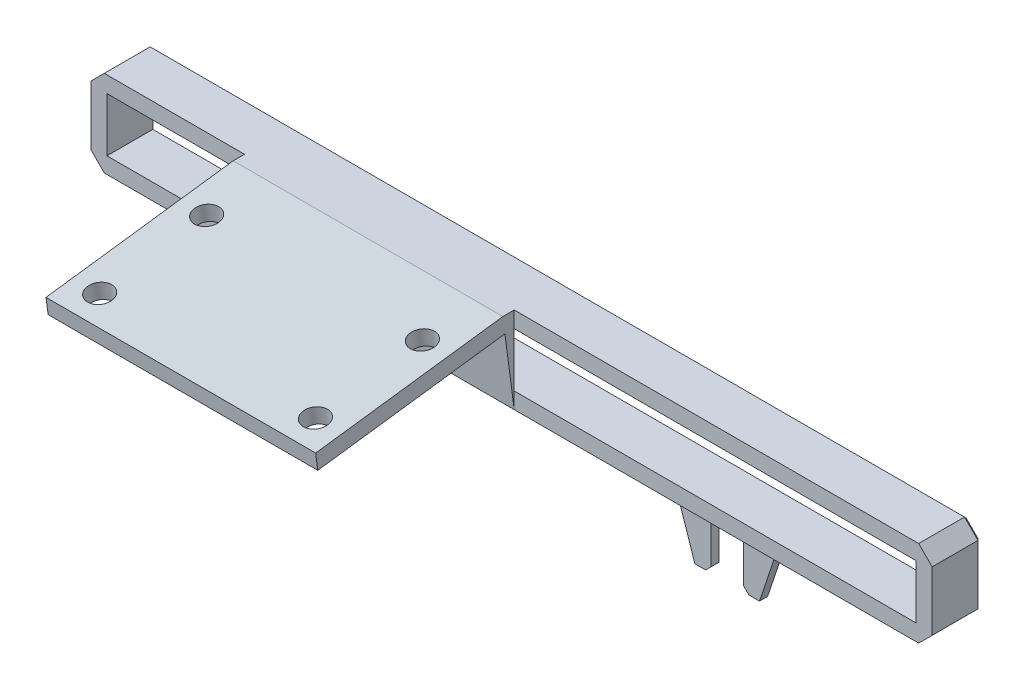
from build123d import *
from OCP.BRepFilletAPI import BRepFilletAPI_MakeChamfer

# Parameters (mm, degrees)
SKETCH1_W            = 156
SKETCH1_H            = 16
BOSS_EXTRUDE1_DEPTH  = 9
SKETCH2_W            = 150
SKETCH2_H            = 10
CUT_EXTRUDE1_DEPTH   = 9
BOSS_EXTRUDE2_START  = -127.5
BOSS_EXTRUDE2_DEPTH  = 50
SKETCH5_W            = 50
SKETCH5_H            = 3
BOSS_EXTRUDE3_DEPTH  = 35
M4_CLEARANCE_HOLE1_D = 4.5
SKETCH10_W           = 12
SKETCH10_H           = 2
BOSS_EXTRUDE4_DEPTH  = 15
SKETCH11_W           = 6
SKETCH11_H           = 11
CUT_EXTRUDE2_DEPTH   = 15
CHAMFER1_SIZE        = 5
CHAMFER1_SIZE_2      = 15
CHAMFER2_SIZE        = 1
CHAMFER3_SIZE        = 2.5
CHAMFER4_SIZE        = 2
CHAMFER5_SIZE        = 0.5


# Some blends are built 0.0001 mm under size
with BuildPart() as part:
    # Sketch1 → Boss-Extrude1 (new body)
    with BuildSketch(Plane.XY):
        with Locations((78, 8)):
            Rectangle(SKETCH1_W, SKETCH1_H)
    extrude(amount=BOSS_EXTRUDE1_DEPTH)

    # Sketch2 → Cut-Extrude1 (cut)
    with BuildSketch(Plane.XY.offset(9)):
        with Locations((78, 8)):
            Rectangle(SKETCH2_W, SKETCH2_H)
    extrude(amount=-CUT_EXTRUDE1_DEPTH, mode=Mode.SUBTRACT)

    # Sketch4 → Boss-Extrude2 (add)
    with BuildSketch(Plane(origin=(156, 0, 0), x_dir=(0, 0, -1), z_dir=(1, 0, 0)).offset(BOSS_EXTRUDE2_START)):
        Polygon((-9, 16), (-11.106439961, 16), (-9, 0), align=None)
    extrude(amount=BOSS_EXTRUDE2_DEPTH)

    # Sketch5 → Boss-Extrude3 (add)
    with BuildSketch(Plane(origin=(0, -1.164685703, 8.846666218), x_dir=(1, 0, 0), z_dir=(0, -0.13052619222004497, 0.9914448613738114))):
        with Locations((53.5, 15.812799099)):
            Rectangle(SKETCH5_W, SKETCH5_H)
    extrude(amount=BOSS_EXTRUDE3_DEPTH)

    # M4 Clearance Hole1 (through all)
    with Locations(Plane(origin=(0, 17.164685703, 2.259773743), x_dir=(1, 0, 0), z_dir=(0, 0.9914448613738114, 0.130526192220045))):
        with Locations((33.5, -18.923003752), (73.5, -18.923003752), (73.5, -38.923003752), (33.5, -38.923003752)):
            Hole(M4_CLEARANCE_HOLE1_D / 2)

    # Sketch10 → Boss-Extrude4 (add)
    with BuildSketch(Plane.XZ):
        with Locations((111, 1)):
            Rectangle(SKETCH10_W, SKETCH10_H)
    extrude(amount=BOSS_EXTRUDE4_DEPTH)

    # Sketch11 → Cut-Extrude2 (cut)
    with BuildSketch(Plane(origin=(0, 0, 0), x_dir=(-1, 0, 0), z_dir=(0, 0, -1))):
        with Locations((-111, -9.5)):
            Rectangle(SKETCH11_W, SKETCH11_H)
    extrude(amount=-CUT_EXTRUDE2_DEPTH, mode=Mode.SUBTRACT)

    # Chamfer1
    chamfer1_edges_1 = [part.edges().sort_by_distance(p)[0] for p in [
        (117, 0, 1),
    ]]
    chamfer1_side_1 = [part.faces().sort_by_distance(p)[0] for p in [
        (117.1, 0, 1),
    ]]
    chamfer1_edges_2 = [part.edges().sort_by_distance(p)[0] for p in [
        (105, 0, 1),
    ]]
    chamfer1_side_2 = [part.faces().sort_by_distance(p)[0] for p in [
        (104.9, 0, 1),
    ]]
    chamfer1 = BRepFilletAPI_MakeChamfer(part.part.solid().wrapped)
    for e in chamfer1_edges_1:
        chamfer1.Add(CHAMFER1_SIZE - 0.0001, CHAMFER1_SIZE_2 - 0.0001, e.wrapped, chamfer1_side_1[0].wrapped)
    for e in chamfer1_edges_2:
        chamfer1.Add(CHAMFER1_SIZE - 0.0001, CHAMFER1_SIZE_2 - 0.0001, e.wrapped, chamfer1_side_2[0].wrapped)
    add(Compound.cast(chamfer1.Shape()), mode=Mode.REPLACE)  # a hair under: the kernel refuses the full size

    # Chamfer2
    chamfer2_edges = [part.edges().sort_by_distance(p)[0] for p in [
        (108, -15, 1),
        (114, -15, 1),
    ]]
    chamfer(chamfer2_edges, length=CHAMFER2_SIZE)

    # Chamfer3
    chamfer3_edges = [part.edges().sort_by_distance(p)[0] for p in [
        (0, 16, 4.5),
        (156, 16, 4.5),
        (156, 0, 4.5),
        (0, 0, 4.5),
    ]]
    chamfer(chamfer3_edges, length=CHAMFER3_SIZE)

    # Chamfer4
    chamfer4_edges = [part.edges().sort_by_distance(p)[0] for p in [
        (111, 0, 2),
    ]]
    chamfer(chamfer4_edges, length=CHAMFER4_SIZE)

    # Chamfer5
    # the kernel refuses this chamfer: 0.5 mm, written as the material it takes off along each edge
    with BuildSketch(Plane(origin=(114, -4, 0), x_dir=(-0.027495876610582174, 0, 0.9996219169112968), z_dir=(0, -1, 0)), Plane(origin=(108, -15.285841494, 0), x_dir=(0.027495876610582174, 0, 0.9996219169112968), z_dir=(0, 1, 0))) as chamfer5_piece_1:
        Polygon((CHAMFER5_SIZE * 0.999621916911, -CHAMFER5_SIZE * 0.0274958766106), (-CHAMFER5_SIZE * 0.0274958766106, -CHAMFER5_SIZE * 0.999621916911), (0, 0), align=None)
    extrude(amount=11.285841494, mode=Mode.SUBTRACT)
    with BuildSketch(Plane(origin=(108, -4, 0), x_dir=(0, -0.02749587661058563, 0.9996219169112968), z_dir=(1, 0, 0))) as chamfer5_piece_2:
        Polygon((CHAMFER5_SIZE * 0.999621916911, -CHAMFER5_SIZE * 0.0274958766106), (-CHAMFER5_SIZE * 0.0274958766106, -CHAMFER5_SIZE * 0.999621916911), (0, 0), align=None)
    extrude(amount=6, mode=Mode.SUBTRACT)
    with BuildSketch(Plane(origin=(120.714058506, 0, 0), x_dir=(0, -0.027495876610586372, 0.9996219169112968), z_dir=(1, 0, 0))) as chamfer5_piece_3_section:
        Polygon((CHAMFER5_SIZE * 0.999621916911, -CHAMFER5_SIZE * 0.0274958766106), (-CHAMFER5_SIZE * 0.0274958766106, -CHAMFER5_SIZE * 0.999621916911), (0, 0), align=None)
    chamfer5_piece_3 = extrude(amount=34.071782988, mode=Mode.PRIVATE)
    chamfer5_piece_3 = split(chamfer5_piece_3, bisect_by=Plane(origin=(123.691323229, 5.074337344, 0.164983246), z_dir=(0.9486845629641077, -0.31622397125075763, 0)), keep=Keep.TOP, mode=Mode.PRIVATE)
    add(chamfer5_piece_3, mode=Mode.SUBTRACT)
    with BuildSketch(Plane(origin=(122.406513904, 1.219857976, 0), x_dir=(0.026084913685623757, -0.008694855294818641, 0.999621916911297), z_dir=(-0.31622397125075763, -0.9486845629641077, 0))) as chamfer5_piece_4_section:
        Polygon((CHAMFER5_SIZE * 0.999621916911, CHAMFER5_SIZE * 0.0274958766106), (-CHAMFER5_SIZE * 0.0274958766106, CHAMFER5_SIZE * 0.999621916911), (0, 0), align=None)
    chamfer5_piece_4 = extrude(amount=18.382944798, mode=Mode.PRIVATE)
    chamfer5_piece_4 = split(chamfer5_piece_4, bisect_by=Plane(origin=(119.414869386, 0, 0.166750545), z_dir=(0, -1, 0)), keep=Keep.TOP, mode=Mode.PRIVATE)
    add(chamfer5_piece_4, mode=Mode.SUBTRACT)
    with BuildSketch(Plane(origin=(99.593486096, 1.219857976, 0), x_dir=(0.948325881374337, 0.31610441231498504, -0.027495876610587087), z_dir=(0.31622397125075763, -0.9486845629641077, 0))) as chamfer5_piece_5_section:
        Polygon((CHAMFER5_SIZE * 0.999621916911, CHAMFER5_SIZE * 0.0274958766106), (-CHAMFER5_SIZE * 0.0274958766106, CHAMFER5_SIZE * 0.999621916911), (0, 0), align=None)
    chamfer5_piece_5 = extrude(amount=18.382944798, mode=Mode.PRIVATE)
    chamfer5_piece_5 = split(chamfer5_piece_5, bisect_by=Plane(origin=(102.585130614, 0, 0.166750545), z_dir=(0, -1, 0)), keep=Keep.TOP, mode=Mode.PRIVATE)
    add(chamfer5_piece_5, mode=Mode.SUBTRACT)
    with BuildSketch(Plane(origin=(118.285841494, -15, 0), x_dir=(0, -0.02749587661058563, 0.9996219169112968), z_dir=(-1, 0, 0)), Plane(origin=(108.285841494, -15, 0), x_dir=(0, -0.02749587661058563, 0.9996219169112968), z_dir=(-1, 0, 0))) as chamfer5_piece_6:
        Polygon((CHAMFER5_SIZE * 0.999621916911, CHAMFER5_SIZE * 0.0274958766106), (-CHAMFER5_SIZE * 0.0274958766106, CHAMFER5_SIZE * 0.999621916911), (0, 0), align=None)
    extrude(amount=4.571682988, mode=Mode.SUBTRACT)
    with BuildSketch(Plane(origin=(113.09077276, -13.09077276, 0), x_dir=(-0.01944252080601897, -0.01944252080601897, 0.9996219169112965), z_dir=(0.7071067811865476, -0.7071067811865476, 0)), Plane(origin=(106.09077276, -15.90922724, 0), x_dir=(0.019442520806029328, -0.019442520806029328, 0.9996219169112961), z_dir=(0.7071067811865476, 0.7071067811865476, 0))) as chamfer5_piece_7:
        Polygon((CHAMFER5_SIZE * 0.999621916911, -CHAMFER5_SIZE * 0.0274958766106), (-CHAMFER5_SIZE * 0.0274958766106, -CHAMFER5_SIZE * 0.999621916911), (0, 0), align=None)
    extrude(amount=3.98589655, mode=Mode.SUBTRACT)
    with BuildSketch(Plane(origin=(1.214158506, 0, 0), x_dir=(0, -0.027495876610586372, 0.9996219169112968), z_dir=(1, 0, 0))) as chamfer5_piece_8_section:
        Polygon((CHAMFER5_SIZE * 0.999621916911, -CHAMFER5_SIZE * 0.0274958766106), (-CHAMFER5_SIZE * 0.0274958766106, -CHAMFER5_SIZE * 0.999621916911), (0, 0), align=None)
    chamfer5_piece_8 = extrude(amount=100.071782988, mode=Mode.PRIVATE)
    chamfer5_piece_8 = split(chamfer5_piece_8, bisect_by=Plane(origin=(95.008721747, 14.974334417, 0.164925467), z_dir=(-0.9486845629641077, -0.31622397125075763, 0)), keep=Keep.TOP, mode=Mode.PRIVATE)
    add(chamfer5_piece_8, mode=Mode.SUBTRACT)
    with BuildSketch(Plane(origin=(0, 14.785841494, 0), x_dir=(-0.027495876610586372, 0, 0.9996219169112968), z_dir=(0, -1, 0)), Plane(origin=(156, 1.214158506, 0), x_dir=(0.027495876610582174, 0, 0.9996219169112968), z_dir=(0, 1, 0))) as chamfer5_piece_9:
        Polygon((CHAMFER5_SIZE * 0.999621916911, -CHAMFER5_SIZE * 0.0274958766106), (-CHAMFER5_SIZE * 0.0274958766106, -CHAMFER5_SIZE * 0.999621916911), (0, 0), align=None)
    extrude(amount=13.571682988, mode=Mode.SUBTRACT)
    with BuildSketch(Plane(origin=(154.785841494, 16, 0), x_dir=(0, 0.02749587661058908, 0.9996219169112968), z_dir=(-1, 0, 0))) as chamfer5_piece_10:
        Polygon((CHAMFER5_SIZE * 0.999621916911, -CHAMFER5_SIZE * 0.0274958766106), (-CHAMFER5_SIZE * 0.0274958766106, -CHAMFER5_SIZE * 0.999621916911), (0, 0), align=None)
    extrude(amount=153.571682988, mode=Mode.SUBTRACT)
    with BuildSketch(Plane(origin=(152.59077276, -0.90922724, 0), x_dir=(0.01944252080600009, -0.01944252080600009, 0.9996219169112972), z_dir=(0.7071067811865476, 0.7071067811865476, 0)), Plane(origin=(156.90922724, 12.59077276, 0), x_dir=(0.019442520806003442, 0.019442520806003442, 0.9996219169112972), z_dir=(-0.7071067811865476, 0.7071067811865476, 0)), Plane(origin=(3.40922724, 16.90922724, 0), x_dir=(-0.01944252080601509, 0.01944252080601509, 0.9996219169112968), z_dir=(-0.7071067811865476, -0.7071067811865476, 0))) as chamfer5_piece_11:
        Polygon((CHAMFER5_SIZE * 0.999621916911, -CHAMFER5_SIZE * 0.0274958766106), (-CHAMFER5_SIZE * 0.0274958766106, -CHAMFER5_SIZE * 0.999621916911), (0, 0), align=None)
    extrude(amount=6.107216894, mode=Mode.SUBTRACT)
    with BuildSketch(Plane(origin=(3.40922724, -0.90922724, 0), x_dir=(-0.019442520806014007, -0.019442520806014007, 0.9996219169112968), z_dir=(-0.7071067811865476, 0.7071067811865476, 0))) as chamfer5_piece_12:
        Polygon((CHAMFER5_SIZE * 0.999621916911, CHAMFER5_SIZE * 0.0274958766106), (-CHAMFER5_SIZE * 0.0274958766106, CHAMFER5_SIZE * 0.999621916911), (0, 0), align=None)
    extrude(amount=6.107216894, mode=Mode.SUBTRACT)
    with BuildSketch(Plane(origin=(3, 3, 0), x_dir=(0, 0.027495876610586494, 0.9996219169112968), z_dir=(1, 0, 0)), Plane(origin=(153, 13, 0), x_dir=(0, -0.02749587661058563, 0.9996219169112968), z_dir=(-1, 0, 0))) as chamfer5_piece_13:
        Polygon((CHAMFER5_SIZE * 0.999621916911, CHAMFER5_SIZE * 0.0274958766106), (-CHAMFER5_SIZE * 0.0274958766106, CHAMFER5_SIZE * 0.999621916911), (0, 0), align=None)
    extrude(amount=150, mode=Mode.SUBTRACT)
    with BuildSketch(Plane(origin=(3, 13, 0), x_dir=(0.027495876610586494, 0, 0.9996219169112968), z_dir=(0, -1, 0)), Plane(origin=(153, 3, 0), x_dir=(-0.027495876610582174, 0, 0.9996219169112968), z_dir=(0, 1, 0))) as chamfer5_piece_14:
        Polygon((CHAMFER5_SIZE * 0.999621916911, CHAMFER5_SIZE * 0.0274958766106), (-CHAMFER5_SIZE * 0.0274958766106, CHAMFER5_SIZE * 0.999621916911), (0, 0), align=None)
    extrude(amount=10, mode=Mode.SUBTRACT)
    with BuildSketch(Plane(origin=(114, -2.714158506, 0), x_dir=(-0.027495876610582174, 0, 0.9996219169112968), z_dir=(0, -1, 0))) as chamfer5_piece_15a_section:
        Polygon((CHAMFER5_SIZE * 0.999621916911, -CHAMFER5_SIZE * 0.0274958766106), (-CHAMFER5_SIZE * 0.0274958766106, -CHAMFER5_SIZE * 0.999621916911), (0, 0), align=None)
    chamfer5_piece_15a = extrude(amount=12.571682988, mode=Mode.PRIVATE)
    chamfer5_piece_15a = split(chamfer5_piece_15a, bisect_by=Plane(origin=(114.164896813, -4, 0.164896813), z_dir=(0, 1, 0)), keep=Keep.TOP, mode=Mode.PRIVATE)
    with BuildSketch(Plane(origin=(108, -4, 0), x_dir=(0, -0.02749587661058563, 0.9996219169112968), z_dir=(1, 0, 0))) as chamfer5_piece_15b_section:
        Polygon((CHAMFER5_SIZE * 0.999621916911, -CHAMFER5_SIZE * 0.0274958766106), (-CHAMFER5_SIZE * 0.0274958766106, -CHAMFER5_SIZE * 0.999621916911), (0, 0), align=None)
    chamfer5_piece_15b = extrude(amount=7.285841494, mode=Mode.PRIVATE)
    chamfer5_piece_15b = split(chamfer5_piece_15b, bisect_by=Plane(origin=(114, -3.835103187, 0.164896813), z_dir=(1, 0, 0)), keep=Keep.TOP, mode=Mode.PRIVATE)
    chamfer5_piece_15 = chamfer5_piece_15a & chamfer5_piece_15b
    add(chamfer5_piece_15, mode=Mode.SUBTRACT)
    with BuildSketch(Plane(origin=(106.714158506, -4, 0), x_dir=(0, -0.02749587661058563, 0.9996219169112968), z_dir=(1, 0, 0))) as chamfer5_piece_16a_section:
        Polygon((CHAMFER5_SIZE * 0.999621916911, -CHAMFER5_SIZE * 0.0274958766106), (-CHAMFER5_SIZE * 0.0274958766106, -CHAMFER5_SIZE * 0.999621916911), (0, 0), align=None)
    chamfer5_piece_16a = extrude(amount=7.285841494, mode=Mode.PRIVATE)
    chamfer5_piece_16a = split(chamfer5_piece_16a, bisect_by=Plane(origin=(108, -3.835103187, 0.164896813), z_dir=(-1, 0, 0)), keep=Keep.TOP, mode=Mode.PRIVATE)
    with BuildSketch(Plane(origin=(108, -15.285841494, 0), x_dir=(0.027495876610582174, 0, 0.9996219169112968), z_dir=(0, 1, 0))) as chamfer5_piece_16b_section:
        Polygon((CHAMFER5_SIZE * 0.999621916911, -CHAMFER5_SIZE * 0.0274958766106), (-CHAMFER5_SIZE * 0.0274958766106, -CHAMFER5_SIZE * 0.999621916911), (0, 0), align=None)
    chamfer5_piece_16b = extrude(amount=12.571682988, mode=Mode.PRIVATE)
    chamfer5_piece_16b = split(chamfer5_piece_16b, bisect_by=Plane(origin=(107.835103187, -4, 0.164896813), z_dir=(0, 1, 0)), keep=Keep.TOP, mode=Mode.PRIVATE)
    chamfer5_piece_16 = chamfer5_piece_16a & chamfer5_piece_16b
    add(chamfer5_piece_16, mode=Mode.SUBTRACT)
    with BuildSketch(Plane(origin=(120.714058506, 0, 0), x_dir=(0, -0.027495876610586372, 0.9996219169112968), z_dir=(1, 0, 0))) as chamfer5_piece_17a_section:
        Polygon((CHAMFER5_SIZE * 0.999621916911, -CHAMFER5_SIZE * 0.0274958766106), (-CHAMFER5_SIZE * 0.0274958766106, -CHAMFER5_SIZE * 0.999621916911), (0, 0), align=None)
    chamfer5_piece_17a = extrude(amount=34.071782988, mode=Mode.PRIVATE)
    chamfer5_piece_17a = split(chamfer5_piece_17a, bisect_by=Plane(origin=(121.989075947, -0.032472593, 0.162786872), z_dir=(-0.9486845629641077, 0.31622397125075763, 0)), keep=Keep.TOP, mode=Mode.PRIVATE)
    with BuildSketch(Plane(origin=(122.406513904, 1.219857976, 0), x_dir=(0.026084913685623757, -0.008694855294818641, 0.999621916911297), z_dir=(-0.31622397125075763, -0.9486845629641077, 0))) as chamfer5_piece_17b_section:
        Polygon((CHAMFER5_SIZE * 0.999621916911, CHAMFER5_SIZE * 0.0274958766106), (-CHAMFER5_SIZE * 0.0274958766106, CHAMFER5_SIZE * 0.999621916911), (0, 0), align=None)
    chamfer5_piece_17b = extrude(amount=18.382944798, mode=Mode.PRIVATE)
    chamfer5_piece_17b = split(chamfer5_piece_17b, bisect_by=Plane(origin=(122.034129073, 0, 0.162786872), z_dir=(0, 1, 0)), keep=Keep.TOP, mode=Mode.PRIVATE)
    chamfer5_piece_17 = chamfer5_piece_17a & chamfer5_piece_17b
    add(chamfer5_piece_17, mode=Mode.SUBTRACT)
    with BuildSketch(Plane(origin=(1.214158506, 0, 0), x_dir=(0, -0.027495876610586372, 0.9996219169112968), z_dir=(1, 0, 0))) as chamfer5_piece_18a_section:
        Polygon((CHAMFER5_SIZE * 0.999621916911, -CHAMFER5_SIZE * 0.0274958766106), (-CHAMFER5_SIZE * 0.0274958766106, -CHAMFER5_SIZE * 0.999621916911), (0, 0), align=None)
    chamfer5_piece_18a = extrude(amount=100.071782988, mode=Mode.PRIVATE)
    chamfer5_piece_18a = split(chamfer5_piece_18a, bisect_by=Plane(origin=(100.010924053, -0.032472593, 0.162786872), z_dir=(0.9486845629641077, 0.31622397125075763, 0)), keep=Keep.TOP, mode=Mode.PRIVATE)
    with BuildSketch(Plane(origin=(99.593486096, 1.219857976, 0), x_dir=(0.948325881374337, 0.31610441231498504, -0.027495876610587087), z_dir=(0.31622397125075763, -0.9486845629641077, 0))) as chamfer5_piece_18b_section:
        Polygon((CHAMFER5_SIZE * 0.999621916911, CHAMFER5_SIZE * 0.0274958766106), (-CHAMFER5_SIZE * 0.0274958766106, CHAMFER5_SIZE * 0.999621916911), (0, 0), align=None)
    chamfer5_piece_18b = extrude(amount=18.382944798, mode=Mode.PRIVATE)
    chamfer5_piece_18b = split(chamfer5_piece_18b, bisect_by=Plane(origin=(99.965870927, 0, 0.162786872), z_dir=(0, 1, 0)), keep=Keep.TOP, mode=Mode.PRIVATE)
    chamfer5_piece_18 = chamfer5_piece_18a & chamfer5_piece_18b
    add(chamfer5_piece_18, mode=Mode.SUBTRACT)
    with BuildSketch(Plane(origin=(1.714158506, 3, 0), x_dir=(0, 0.027495876610586494, 0.9996219169112968), z_dir=(1, 0, 0))) as chamfer5_piece_19a_section:
        Polygon((CHAMFER5_SIZE * 0.999621916911, CHAMFER5_SIZE * 0.0274958766106), (-CHAMFER5_SIZE * 0.0274958766106, CHAMFER5_SIZE * 0.999621916911), (0, 0), align=None)
    chamfer5_piece_19a = extrude(amount=151.285841494, mode=Mode.PRIVATE)
    chamfer5_piece_19a = split(chamfer5_piece_19a, bisect_by=Plane(origin=(3, 2.835103187, 0.164896813), z_dir=(-1, 0, 0)), keep=Keep.TOP, mode=Mode.PRIVATE)
    with BuildSketch(Plane(origin=(3, 13, 0), x_dir=(0.027495876610586494, 0, 0.9996219169112968), z_dir=(0, -1, 0))) as chamfer5_piece_19b_section:
        Polygon((CHAMFER5_SIZE * 0.999621916911, CHAMFER5_SIZE * 0.0274958766106), (-CHAMFER5_SIZE * 0.0274958766106, CHAMFER5_SIZE * 0.999621916911), (0, 0), align=None)
    chamfer5_piece_19b = extrude(amount=11.285841494, mode=Mode.PRIVATE)
    chamfer5_piece_19b = split(chamfer5_piece_19b, bisect_by=Plane(origin=(2.835103187, 3, 0.164896813), z_dir=(0, -1, 0)), keep=Keep.TOP, mode=Mode.PRIVATE)
    chamfer5_piece_19 = chamfer5_piece_19a & chamfer5_piece_19b
    add(chamfer5_piece_19, mode=Mode.SUBTRACT)
    with BuildSketch(Plane(origin=(3, 3, 0), x_dir=(0, 0.027495876610586494, 0.9996219169112968), z_dir=(1, 0, 0))) as chamfer5_piece_20a_section:
        Polygon((CHAMFER5_SIZE * 0.999621916911, CHAMFER5_SIZE * 0.0274958766106), (-CHAMFER5_SIZE * 0.0274958766106, CHAMFER5_SIZE * 0.999621916911), (0, 0), align=None)
    chamfer5_piece_20a = extrude(amount=151.285841494, mode=Mode.PRIVATE)
    chamfer5_piece_20a = split(chamfer5_piece_20a, bisect_by=Plane(origin=(153, 2.835103187, 0.164896813), z_dir=(1, 0, 0)), keep=Keep.TOP, mode=Mode.PRIVATE)
    with BuildSketch(Plane(origin=(153, 1.714158506, 0), x_dir=(-0.027495876610582174, 0, 0.9996219169112968), z_dir=(0, 1, 0))) as chamfer5_piece_20b_section:
        Polygon((CHAMFER5_SIZE * 0.999621916911, CHAMFER5_SIZE * 0.0274958766106), (-CHAMFER5_SIZE * 0.0274958766106, CHAMFER5_SIZE * 0.999621916911), (0, 0), align=None)
    chamfer5_piece_20b = extrude(amount=11.285841494, mode=Mode.PRIVATE)
    chamfer5_piece_20b = split(chamfer5_piece_20b, bisect_by=Plane(origin=(153.164896813, 3, 0.164896813), z_dir=(0, -1, 0)), keep=Keep.TOP, mode=Mode.PRIVATE)
    chamfer5_piece_20 = chamfer5_piece_20a & chamfer5_piece_20b
    add(chamfer5_piece_20, mode=Mode.SUBTRACT)
    with BuildSketch(Plane(origin=(3, 14.285841494, 0), x_dir=(0.027495876610586494, 0, 0.9996219169112968), z_dir=(0, -1, 0))) as chamfer5_piece_21a_section:
        Polygon((CHAMFER5_SIZE * 0.999621916911, CHAMFER5_SIZE * 0.0274958766106), (-CHAMFER5_SIZE * 0.0274958766106, CHAMFER5_SIZE * 0.999621916911), (0, 0), align=None)
    chamfer5_piece_21a = extrude(amount=11.285841494, mode=Mode.PRIVATE)
    chamfer5_piece_21a = split(chamfer5_piece_21a, bisect_by=Plane(origin=(2.835103187, 13, 0.164896813), z_dir=(0, 1, 0)), keep=Keep.TOP, mode=Mode.PRIVATE)
    with BuildSketch(Plane(origin=(153, 13, 0), x_dir=(0, -0.02749587661058563, 0.9996219169112968), z_dir=(-1, 0, 0))) as chamfer5_piece_21b_section:
        Polygon((CHAMFER5_SIZE * 0.999621916911, CHAMFER5_SIZE * 0.0274958766106), (-CHAMFER5_SIZE * 0.0274958766106, CHAMFER5_SIZE * 0.999621916911), (0, 0), align=None)
    chamfer5_piece_21b = extrude(amount=151.285841494, mode=Mode.PRIVATE)
    chamfer5_piece_21b = split(chamfer5_piece_21b, bisect_by=Plane(origin=(3, 13.164896813, 0.164896813), z_dir=(-1, 0, 0)), keep=Keep.TOP, mode=Mode.PRIVATE)
    chamfer5_piece_21 = chamfer5_piece_21a & chamfer5_piece_21b
    add(chamfer5_piece_21, mode=Mode.SUBTRACT)
    with BuildSketch(Plane(origin=(153, 3, 0), x_dir=(-0.027495876610582174, 0, 0.9996219169112968), z_dir=(0, 1, 0))) as chamfer5_piece_22a_section:
        Polygon((CHAMFER5_SIZE * 0.999621916911, CHAMFER5_SIZE * 0.0274958766106), (-CHAMFER5_SIZE * 0.0274958766106, CHAMFER5_SIZE * 0.999621916911), (0, 0), align=None)
    chamfer5_piece_22a = extrude(amount=11.285841494, mode=Mode.PRIVATE)
    chamfer5_piece_22a = split(chamfer5_piece_22a, bisect_by=Plane(origin=(153.164896813, 13, 0.164896813), z_dir=(0, 1, 0)), keep=Keep.TOP, mode=Mode.PRIVATE)
    with BuildSketch(Plane(origin=(154.285841494, 13, 0), x_dir=(0, -0.02749587661058563, 0.9996219169112968), z_dir=(-1, 0, 0))) as chamfer5_piece_22b_section:
        Polygon((CHAMFER5_SIZE * 0.999621916911, CHAMFER5_SIZE * 0.0274958766106), (-CHAMFER5_SIZE * 0.0274958766106, CHAMFER5_SIZE * 0.999621916911), (0, 0), align=None)
    chamfer5_piece_22b = extrude(amount=151.285841494, mode=Mode.PRIVATE)
    chamfer5_piece_22b = split(chamfer5_piece_22b, bisect_by=Plane(origin=(153, 13.164896813, 0.164896813), z_dir=(1, 0, 0)), keep=Keep.TOP, mode=Mode.PRIVATE)
    chamfer5_piece_22 = chamfer5_piece_22a & chamfer5_piece_22b
    add(chamfer5_piece_22, mode=Mode.SUBTRACT)


solid = part.part
